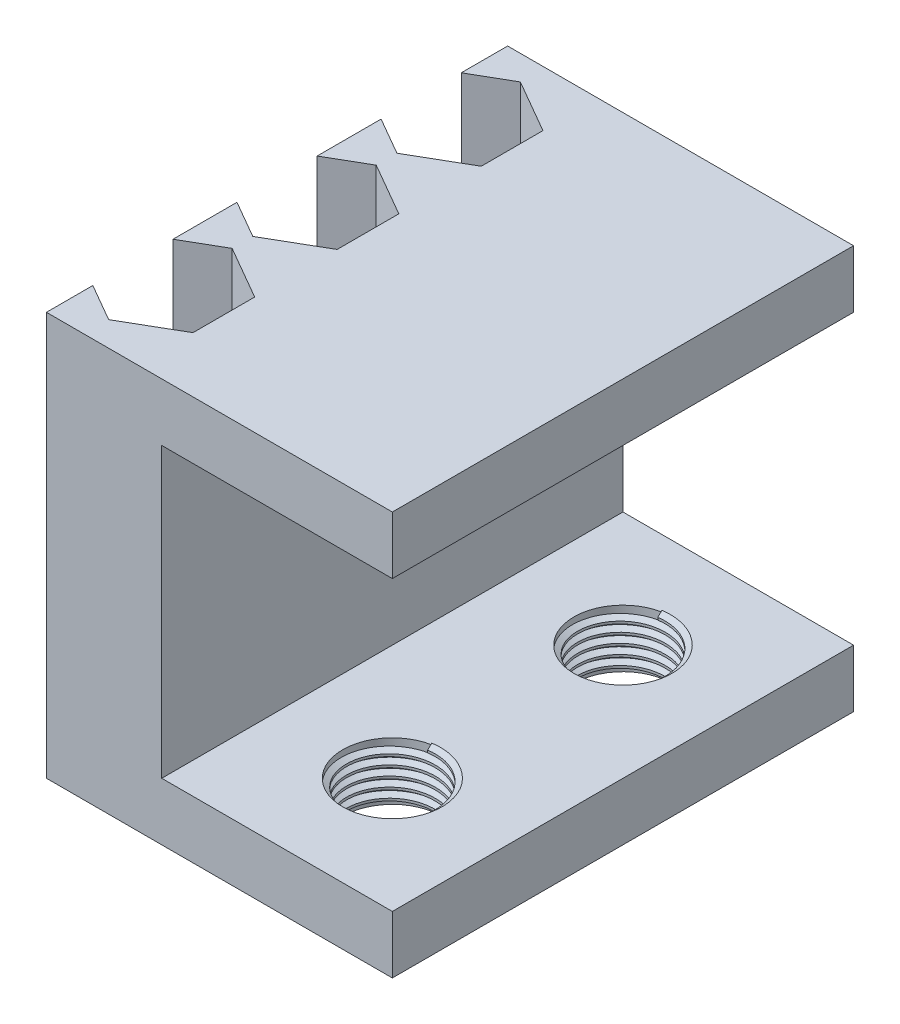
from build123d import *
from build123d.topology import SkipClean

# Parameters (mm, degrees)
SKETCH1_W           = 38.1
SKETCH1_H           = 44.45
BOSS_EXTRUDE1_DEPTH = 50.8
CUT_EXTRUDE1_REACH  = 60.63
SKETCH2_W           = 25.4
SKETCH2_H           = 31.75
CUT_EXTRUDE2_REACH  = 72.138
CUT_EXTRUDE3_DEPTH  = 31.75
CUT_EXTRUDE4_REACH  = 72.138
SKETCH5_R           = 5.461
SKETCH5_R_2         = 5.3975
THREAD1_PITCH       = 1.058333333
THREAD2_PITCH       = 1.058333333
LPATTERN2_COUNT     = 2
LPATTERN2_PITCH     = 15.875
LPATTERN3_START     = -9.525
LPATTERN3_DEPTH     = 31.75
LPATTERN3_START_2   = -23
LPATTERN3_2_DEPTH   = 13.475


with BuildPart() as part:
    # Sketch1 → Boss-Extrude1 (new body)
    with BuildSketch(Plane.XY):
        Rectangle(SKETCH1_W, SKETCH1_H)
    extrude(amount=-BOSS_EXTRUDE1_DEPTH)

    # Sketch2 → Cut-Extrude1 (cut, up to next)
    with BuildSketch(Plane.XY, mode=Mode.PRIVATE) as cut_extrude1_sk1:
        with Locations((6.35, 0)):
            Rectangle(SKETCH2_W, SKETCH2_H)
    cut_extrude1_tool1 = extrude(cut_extrude1_sk1.sketch, amount=-CUT_EXTRUDE1_REACH, mode=Mode.PRIVATE) & part.part
    add(cut_extrude1_tool1.solids().sort_by_distance((6.35, 0, 0))[0], mode=Mode.SUBTRACT)

    # Sketch3 → Cut-Extrude2 (cut, up to next)
    with BuildSketch(Plane(origin=(0, 22.225, 0), x_dir=(1, 0, 0), z_dir=(0, 1, 0)), mode=Mode.PRIVATE) as cut_extrude2_sk1:
        Polygon((-10.795, 27.783013236), (-14.9225, 30.166026472), (-19.05, 27.783013236), (-19.05, 23.016986764), (-14.9225, 20.633973528), (-10.795, 23.016986764), align=None)
    cut_extrude2_tool1 = extrude(cut_extrude2_sk1.sketch, amount=-CUT_EXTRUDE2_REACH, mode=Mode.PRIVATE) & part.part
    cut_extrude2 = cut_extrude2_tool1.solids().sort_by_distance((-14.9225, 22.225, -25.4))[0]
    add(cut_extrude2, mode=Mode.SUBTRACT)

    # Sketch4 → Cut-Extrude3 (cut)
    with BuildSketch(Plane(origin=(0, 22.225, 0), x_dir=(1, 0, 0), z_dir=(0, 1, 0))):
        Polygon((-19.05, 29.815013236), (-14.9225, 32.198026472), (-9.03523638, 28.799013236), (-9.03523638, 22.000986764), (-14.9225, 18.601973528), (-19.05, 20.984986764), (-19.05, 23.016986764), (-14.9225, 20.633973528), (-10.795, 23.016986764), (-10.795, 27.783013236), (-14.9225, 30.166026472), (-19.05, 27.783013236), align=None)
    cut_extrude3 = extrude(amount=-CUT_EXTRUDE3_DEPTH, mode=Mode.SUBTRACT)

    # Sketch5 → Cut-Extrude4 (cut, up to next)
    with BuildSketch(Plane.XZ.offset(22.225), mode=Mode.PRIVATE) as cut_extrude4_sk1:
        with Locations(Location((6.35, -12.7, 0), (0, 0, 270))):
            Circle(SKETCH5_R)
    cut_extrude4_tool1 = extrude(cut_extrude4_sk1.sketch, amount=-CUT_EXTRUDE4_REACH, mode=Mode.PRIVATE) & part.part
    # Sketch5 → Cut-Extrude4 (cut, up to next)
    with BuildSketch(Plane.XZ.offset(22.225), mode=Mode.PRIVATE) as cut_extrude4_sk2:
        with Locations(Location((6.35, -38.1, 0), (0, 0, 270))):
            Circle(SKETCH5_R_2)
    cut_extrude4_tool2 = extrude(cut_extrude4_sk2.sketch, amount=-CUT_EXTRUDE4_REACH, mode=Mode.PRIVATE) & part.part
    add(cut_extrude4_tool1.solids().sort_by_distance((6.35, -22.225, -12.7))[0], mode=Mode.SUBTRACT)
    add(cut_extrude4_tool2.solids().sort_by_distance((6.35, -22.225, -38.1))[0], mode=Mode.SUBTRACT)

    # Thread1: arcs per turn and ends read off the stored shape
    # Thread1: the profile of Thread Profile1 profile screwed along a right-hand helix through 5.28 turns, 8 arcs to a turn; built about Z, then put on its axis
    with SkipClean():  # the faces are left unmerged after this step: merging them gives an invalid solid
        thread1_z = Axis((0, 0, 0), (0, 0, 1))
        thread1_corners = [(5.4613, 0, -0.000173205), (5.4613, 0, 0.926214869), (4.888160282, 0, 0.595312499), (4.888160282, 0, 0.330729165)]
        with BuildLine(mode=Mode.PRIVATE) as thread1_profile:
            Line(thread1_corners[0], thread1_corners[1])
            Line(thread1_corners[1], thread1_corners[2])
            Line(thread1_corners[2], thread1_corners[3])
            Line(thread1_corners[3], thread1_corners[0])
        thread1_cap = Face(thread1_profile.wire())
        thread1_turn_angles = [0, 22.5, 45, 67.5, 90, 112.5, 135, 157.5, 180, 202.5, 225, 247.5, 270, 292.5, 315, 337.5, 360]
        thread1_turn_weights = [1, 0.9238795325112867, 1, 0.9238795325112867, 1, 0.9238795325112867, 1, 0.9238795325112867, 1, 0.9238795325112867, 1, 0.9238795325112867, 1, 0.9238795325112867, 1, 0.9238795325112867, 1]
        thread1_turn_rails = [Edge.make_bspline([Vector(p[0], p[1], 0).rotate(thread1_z, thread1_turn_angles[k]) / thread1_turn_weights[k] + Vector(0, 0, p[2] + THREAD1_PITCH * thread1_turn_angles[k] / 360) for k in range(17)], [0, 0, 0, 1, 1, 2, 2, 3, 3, 4, 4, 5, 5, 6, 6, 7, 7, 8, 8, 8], 2, thread1_turn_weights) for p in thread1_corners]
        thread1_turn_sides = [Face.make_surface_from_curves(thread1_turn_rails[p[0]], thread1_turn_rails[p[1]]) for p in [(0, 1), (1, 2), (2, 3), (3, 0)]]
        thread1_last_angles = [1800, 1822.5, 1845, 1867.5, 1890, 1895.4, 1900.8]
        thread1_last_weights = [1, 0.9238795325112867, 1, 0.9238795325112867, 1, 0.99556196460308, 1]
        thread1_last_rails = [Edge.make_bspline([Vector(p[0], p[1], 0).rotate(thread1_z, thread1_last_angles[k]) / thread1_last_weights[k] + Vector(0, 0, p[2] + THREAD1_PITCH * thread1_last_angles[k] / 360) for k in range(7)], [0, 0, 0, 1, 1, 2, 2, 3, 3, 3], 2, thread1_last_weights) for p in thread1_corners]
        thread1_last_sides = [Face.make_surface_from_curves(thread1_last_rails[p[0]], thread1_last_rails[p[1]]) for p in [(0, 1), (1, 2), (2, 3), (3, 0)]]
        thread1 = Plane(origin=(6.35, -22.225, -12.7), x_dir=(1, 0, 0), z_dir=(0, 1, 0)) * Solid(Shell([*[p.moved(Location((0, 0, THREAD1_PITCH * i))) for i in range(5) for p in thread1_turn_sides], *thread1_last_sides, thread1_cap, thread1_cap.rotate(thread1_z, 1900.8).moved(Location((0, 0, THREAD1_PITCH * 1900.8 / 360)))]))
        add(thread1)

    # Thread2: arcs per turn and ends read off the stored shape
    # Thread2: the profile of Thread Profile2 profile screwed along a right-hand helix through 5.28 turns, 8 arcs to a turn; built about Z, then put on its axis
    with SkipClean():  # the faces are left unmerged after this step: merging them gives an invalid solid
        thread2_z = Axis((0, 0, 0), (0, 0, 1))
        thread2_corners = [(5.3978, 0, -0.000173205), (5.3978, 0, 0.926214869), (4.824660282, 0, 0.595312499), (4.824660282, 0, 0.330729165)]
        with BuildLine(mode=Mode.PRIVATE) as thread2_profile:
            Line(thread2_corners[0], thread2_corners[1])
            Line(thread2_corners[1], thread2_corners[2])
            Line(thread2_corners[2], thread2_corners[3])
            Line(thread2_corners[3], thread2_corners[0])
        thread2_cap = Face(thread2_profile.wire())
        thread2_turn_angles = [0, 22.5, 45, 67.5, 90, 112.5, 135, 157.5, 180, 202.5, 225, 247.5, 270, 292.5, 315, 337.5, 360]
        thread2_turn_weights = [1, 0.9238795325112867, 1, 0.9238795325112867, 1, 0.9238795325112867, 1, 0.9238795325112867, 1, 0.9238795325112867, 1, 0.9238795325112867, 1, 0.9238795325112867, 1, 0.9238795325112867, 1]
        thread2_turn_rails = [Edge.make_bspline([Vector(p[0], p[1], 0).rotate(thread2_z, thread2_turn_angles[k]) / thread2_turn_weights[k] + Vector(0, 0, p[2] + THREAD2_PITCH * thread2_turn_angles[k] / 360) for k in range(17)], [0, 0, 0, 1, 1, 2, 2, 3, 3, 4, 4, 5, 5, 6, 6, 7, 7, 8, 8, 8], 2, thread2_turn_weights) for p in thread2_corners]
        thread2_turn_sides = [Face.make_surface_from_curves(thread2_turn_rails[p[0]], thread2_turn_rails[p[1]]) for p in [(0, 1), (1, 2), (2, 3), (3, 0)]]
        thread2_last_angles = [1800, 1822.5, 1845, 1867.5, 1890, 1895.4, 1900.8]
        thread2_last_weights = [1, 0.9238795325112867, 1, 0.9238795325112867, 1, 0.99556196460308, 1]
        thread2_last_rails = [Edge.make_bspline([Vector(p[0], p[1], 0).rotate(thread2_z, thread2_last_angles[k]) / thread2_last_weights[k] + Vector(0, 0, p[2] + THREAD2_PITCH * thread2_last_angles[k] / 360) for k in range(7)], [0, 0, 0, 1, 1, 2, 2, 3, 3, 3], 2, thread2_last_weights) for p in thread2_corners]
        thread2_last_sides = [Face.make_surface_from_curves(thread2_last_rails[p[0]], thread2_last_rails[p[1]]) for p in [(0, 1), (1, 2), (2, 3), (3, 0)]]
        thread2 = Plane(origin=(6.35, -22.225, -38.1), x_dir=(1, 0, 0), z_dir=(0, 1, 0)) * Solid(Shell([*[p.moved(Location((0, 0, THREAD2_PITCH * i))) for i in range(5) for p in thread2_turn_sides], *thread2_last_sides, thread2_cap, thread2_cap.rotate(thread2_z, 1900.8).moved(Location((0, 0, THREAD2_PITCH * 1900.8 / 360)))]))
        add(thread2)

    # LPattern2: Cut-Extrude2, Cut-Extrude3 ×2
    with SkipClean():  # the faces are left unmerged after this step: merging them gives an invalid solid
        with Locations(*[(0, 0, i * LPATTERN2_PITCH) for i in range(1, LPATTERN2_COUNT)]):
            add(cut_extrude2, mode=Mode.SUBTRACT)
            add(cut_extrude3, mode=Mode.SUBTRACT)

    # LPattern3: read off the stored shape, not the designer's step
    # LPattern3 outline → LPattern3 (cut)
    with SkipClean():  # the faces are left unmerged after this step: merging them gives an invalid solid
        with BuildSketch(Plane(origin=(0, 0, 0), x_dir=(1, 0, 0), z_dir=(0, 1, 0)).offset(LPATTERN3_START)):
            Polygon((-19.05, 36.859986764), (-14.9225, 34.476973528), (-9.03523638, 37.875986764), (-9.03523638, 44.674013236), (-14.9225, 48.073026472), (-19.05, 45.690013236), align=None)
        extrude(amount=LPATTERN3_DEPTH, mode=Mode.SUBTRACT)

    # LPattern3 2 outline → LPattern3 2 (cut)
    with SkipClean():  # the faces are left unmerged after this step: merging them gives an invalid solid
        with BuildSketch(Plane(origin=(0, 0, 0), x_dir=(1, 0, 0), z_dir=(0, 1, 0)).offset(LPATTERN3_START_2)):
            Polygon((-14.9225, 36.508973528), (-10.795, 38.891986764), (-10.795, 43.658013236), (-14.9225, 46.041026472), (-19.05, 43.658013236), (-19.05, 38.891986764), align=None)
        extrude(amount=LPATTERN3_2_DEPTH, mode=Mode.SUBTRACT)


solid = part.part
